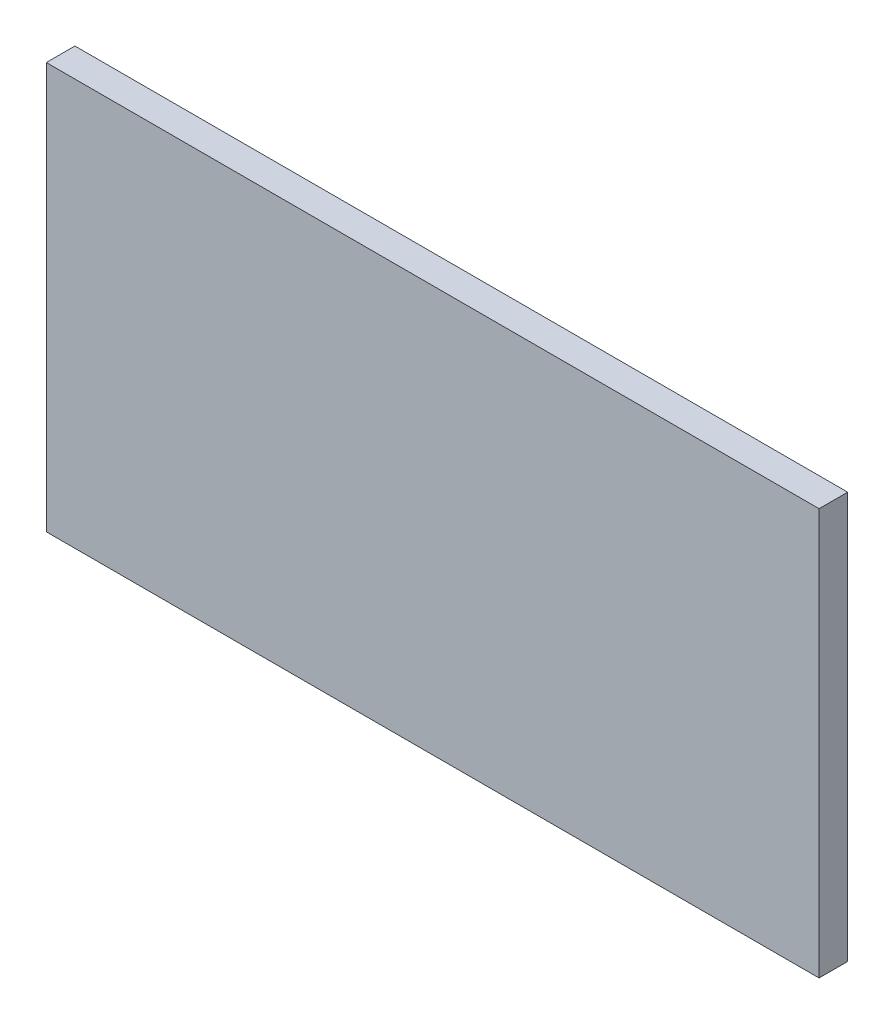
from build123d import *

# Parameters (mm, degrees)
SKETCH1_W           = 270
SKETCH1_H           = 142
BOSS_EXTRUDE1_DEPTH = 5


with BuildPart() as part:
    # Sketch1 → Boss-Extrude1 (new, symmetric)
    with BuildSketch(Plane.XY):
        Rectangle(SKETCH1_W, SKETCH1_H)
    extrude(amount=BOSS_EXTRUDE1_DEPTH, both=True)


solid = part.part
